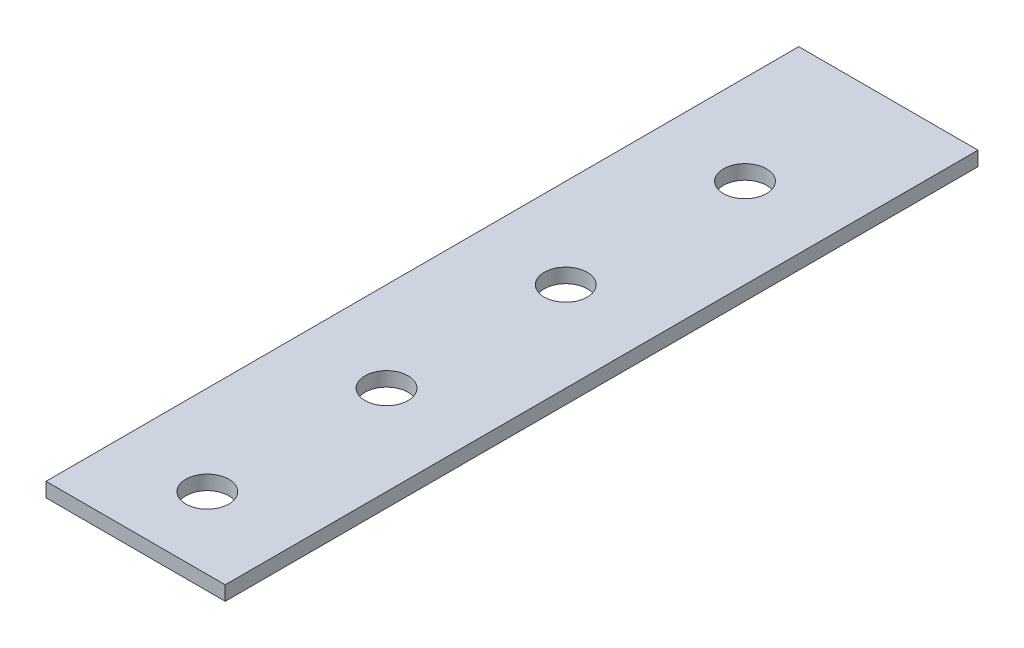
from build123d import *

# Parameters (mm, degrees)
SKETCH1_W           = 25
SKETCH1_H           = 105
BOSS_EXTRUDE1_DEPTH = 2
SKETCH2_R           = 3
CUT_EXTRUDE1_DEPTH  = 55.004629431


with BuildPart() as part:
    # Sketch1 → Boss-Extrude1 (new body)
    with BuildSketch(Plane(origin=(0, 0, 0), x_dir=(1, 0, 0), z_dir=(0, 1, 0))):
        Rectangle(SKETCH1_W, SKETCH1_H)
    extrude(amount=BOSS_EXTRUDE1_DEPTH)

    # Sketch2 → Cut-Extrude1 (cut, through all)
    with BuildSketch(Plane(origin=(0, 2, 0), x_dir=(1, 0, 0), z_dir=(0, 1, 0))):
        with Locations((0, -42.5)):
            Circle(SKETCH2_R)
        with Locations((0, -17.5)):
            Circle(SKETCH2_R)
        with Locations((0, 7.5)):
            Circle(SKETCH2_R)
        with Locations((0, 32.5)):
            Circle(SKETCH2_R)
    extrude(amount=-CUT_EXTRUDE1_DEPTH, mode=Mode.SUBTRACT)


solid = part.part
